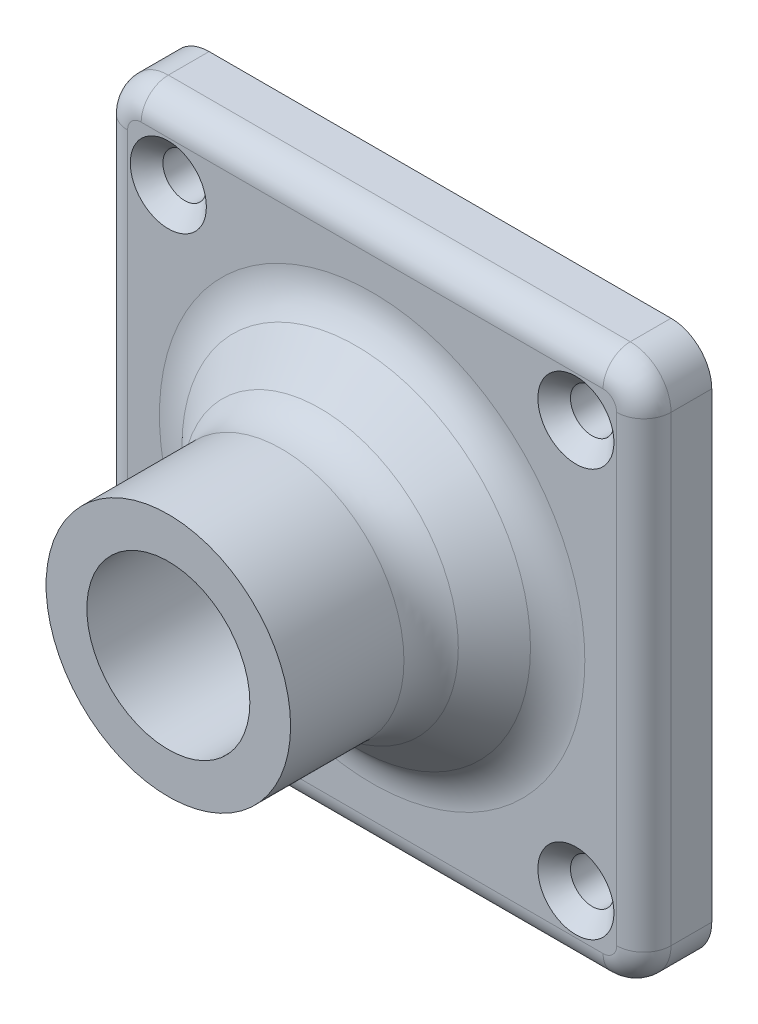
from build123d import *

# Parameters (mm, degrees)
SKETCH2_R           = 9
SKETCH2_R_2         = 6
BOSS_EXTRUDE1_DEPTH = 20
SKETCH3_R           = 6
BOSS_EXTRUDE2_DEPTH = 5
FILLET1_R           = 2
CUT_EXTRUDE1_REACH  = 188.327
SKETCH4_R           = 1.6
CHAMFER1_SIZE       = 5
FILLET2_R           = 4
CHAMFER2_SIZE       = 1.2


with BuildPart() as part:
    # Sketch2 → Boss-Extrude1 (new body)
    with BuildSketch(Plane.XY):
        with Locations((-135, -82.312657819)):
            Circle(SKETCH2_R)
        with Locations((-135, -82.312657819)):
            Circle(SKETCH2_R_2, mode=Mode.SUBTRACT)
    extrude(amount=BOSS_EXTRUDE1_DEPTH)

    # Sketch3 → Boss-Extrude2 (add)
    with BuildSketch(Plane(origin=(0, 0, 0), x_dir=(-1, 0, 0), z_dir=(0, 0, -1))):
        with BuildLine():
            Line((152, -102.312657819), (118, -102.312657819))
            ThreePointArc((118, -102.312657819), (115.878679656, -101.433978162), (115, -99.312657819))
            Line((115, -99.312657819), (115, -65.312657819))
            ThreePointArc((115, -65.312657819), (115.878679656, -63.191337475), (118, -62.312657819))
            Line((118, -62.312657819), (152, -62.312657819))
            ThreePointArc((152, -62.312657819), (154.121320344, -63.191337475), (155, -65.312657819))
            Line((155, -65.312657819), (155, -99.312657819))
            ThreePointArc((155, -99.312657819), (154.121320344, -101.433978162), (152, -102.312657819))
        make_face()
        with Locations((135, -82.312657819)):
            Circle(SKETCH3_R, mode=Mode.SUBTRACT)
    extrude(amount=-BOSS_EXTRUDE2_DEPTH)

    # Fillet1
    fillet1_edges = [part.edges().sort_by_distance(p)[0] for p in [
        (-154.121320344, -101.433978162, 5),
        (-135, -102.312657819, 5),
        (-115.878679656, -101.433978162, 5),
        (-115, -82.312657819, 5),
        (-115.878679656, -63.191337475, 5),
        (-135, -62.312657819, 5),
        (-154.121320344, -63.191337475, 5),
        (-155, -82.312657819, 5),
    ]]
    fillet(fillet1_edges, radius=FILLET1_R)

    # Sketch4 → Cut-Extrude1 (cut, up to next)
    with BuildSketch(Plane.XY.offset(5), mode=Mode.PRIVATE) as cut_extrude1_sk1:
        with Locations((-150, -67.312657819)):
            Circle(SKETCH4_R)
    cut_extrude1_tool1 = extrude(cut_extrude1_sk1.sketch, amount=-CUT_EXTRUDE1_REACH, mode=Mode.PRIVATE) & part.part
    # Sketch4 → Cut-Extrude1 (cut, up to next)
    with BuildSketch(Plane.XY.offset(5), mode=Mode.PRIVATE) as cut_extrude1_sk2:
        with Locations((-120, -67.312657819)):
            Circle(SKETCH4_R)
    cut_extrude1_tool2 = extrude(cut_extrude1_sk2.sketch, amount=-CUT_EXTRUDE1_REACH, mode=Mode.PRIVATE) & part.part
    # Sketch4 → Cut-Extrude1 (cut, up to next)
    with BuildSketch(Plane.XY.offset(5), mode=Mode.PRIVATE) as cut_extrude1_sk3:
        with Locations((-120, -97.312657819)):
            Circle(SKETCH4_R)
    cut_extrude1_tool3 = extrude(cut_extrude1_sk3.sketch, amount=-CUT_EXTRUDE1_REACH, mode=Mode.PRIVATE) & part.part
    # Sketch4 → Cut-Extrude1 (cut, up to next)
    with BuildSketch(Plane.XY.offset(5), mode=Mode.PRIVATE) as cut_extrude1_sk4:
        with Locations((-150, -97.312657819)):
            Circle(SKETCH4_R)
    cut_extrude1_tool4 = extrude(cut_extrude1_sk4.sketch, amount=-CUT_EXTRUDE1_REACH, mode=Mode.PRIVATE) & part.part
    add(cut_extrude1_tool1.solids().sort_by_distance((-150, -67.312658, 5))[0], mode=Mode.SUBTRACT)
    add(cut_extrude1_tool2.solids().sort_by_distance((-120, -67.312658, 5))[0], mode=Mode.SUBTRACT)
    add(cut_extrude1_tool3.solids().sort_by_distance((-120, -97.312658, 5))[0], mode=Mode.SUBTRACT)
    add(cut_extrude1_tool4.solids().sort_by_distance((-150, -97.312658, 5))[0], mode=Mode.SUBTRACT)

    # Chamfer1
    chamfer1_edges = [part.edges().sort_by_distance(p)[0] for p in [
        (-144, -82.312657819, 5),
    ]]
    chamfer(chamfer1_edges, length=CHAMFER1_SIZE)

    # Fillet2
    fillet2_edges = [part.edges().sort_by_distance(p)[0] for p in [
        (-144, -82.312657819, 10),
        (-149, -82.312657819, 5),
    ]]
    fillet(fillet2_edges, radius=FILLET2_R)

    # Chamfer2
    chamfer2_edges = [part.edges().sort_by_distance(p)[0] for p in [
        (-151.6, -67.312657819, 5),
        (-121.6, -67.312657819, 5),
        (-121.6, -97.312657819, 5),
        (-151.6, -97.312657819, 5),
    ]]
    chamfer(chamfer2_edges, length=CHAMFER2_SIZE)


solid = part.part
